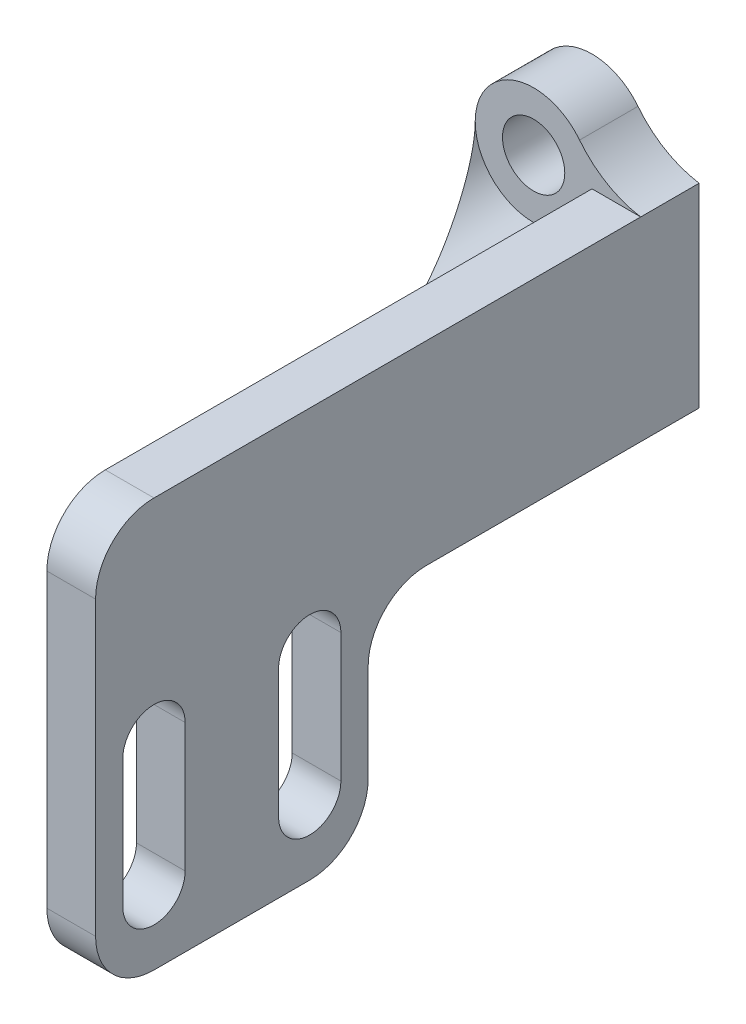
from build123d import *

# Parameters (mm, degrees)
SKETCH_1_R          = 1.6
EXTRUDE_1_DEPTH     = 3
SKETCH_3_W          = 2.5
SKETCH_3_H          = 10
EXTRUDE_2_DEPTH     = 28
FILLET_1_R          = 5
FILLET_2_R          = 5
SKETCH_4_W          = 14
SKETCH_4_H          = 11
EXTRUDE_3_DEPTH     = 2.5
CUT_EXTRUDE_1_DEPTH = 63.851944341
EXTRUDE_4_DEPTH     = 10
SKETCH_8_R          = 3
CUT_EXTRUDE_2_DEPTH = 62.084915548
FILLET_3_R          = 3


with BuildPart() as part:
    # 草图1 → 凸台-拉伸1 (new body)
    with BuildSketch(Plane.XY):
        with BuildLine():
            ThreePointArc((3, -33.010340746), (0, -30.010340746), (-3, -33.010340746))
            Line((-3, -33.010340746), (-3, -43.010340746))
            ThreePointArc((-3, -43.010340746), (0, -46.010340746), (3, -43.010340746))
            Line((3, -43.010340746), (5.5, -43.010340746))
            Line((5.5, -43.010340746), (5.5, -33.010340746))
            Line((5.5, -33.010340746), (3, -33.010340746))
        make_face()
        with Locations((0, -33.010340746)):
            Circle(SKETCH_1_R, mode=Mode.SUBTRACT)
        with Locations((0, -43.010340746)):
            Circle(SKETCH_1_R, mode=Mode.SUBTRACT)
    extrude(amount=EXTRUDE_1_DEPTH)

    # 草图3 → 凸台-拉伸2 (add)
    with BuildSketch(Plane.XY.offset(3)):
        with Locations((4.25, -38.010340746)):
            Rectangle(SKETCH_3_W, SKETCH_3_H)
    extrude(amount=EXTRUDE_2_DEPTH)

    # 圆角1
    # the kernel refuses this fillet: 5 mm, written as the material it adds along each edge
    with BuildSketch(Plane(origin=(3, -43.010340746, 0), x_dir=(-0.32639560491693326, -0.9452332564456825, 0), z_dir=(0, 0, 1))) as fillet_1_piece_1:
        with BuildLine():
            CenterArc((3.590351654, 4.726166282), FILLET_1_R, 208.20428203, 42.745569225)
            Line((-0.815989012, 2.363083141), (0, 0))
            ThreePointArc((0, 0), (0.979186815, 0.164300231), (1.95837363, 0))
        make_face()
    extrude(amount=3)

    # 圆角2
    # the kernel refuses this fillet: 5 mm, written as the material it adds along each edge
    with BuildSketch(Plane(origin=(3, -33.010340746, 0), x_dir=(1, 0, 0), z_dir=(0, 0, 1))) as fillet_2_piece_1:
        with BuildLine():
            CenterArc((3.295454545, 4.936319688), FILLET_2_R, 218.100297491, 42.745569225)
            ThreePointArc((-0.639204545, 1.851119883), (-0.164300231, 0.979186815), (0, 0))
            Line((0, 0), (2.5, 0))
        make_face()
    extrude(amount=3)

    # 草图4 → 凸台-拉伸3 (add)
    with BuildSketch(Plane(origin=(5.5, 0, 0), x_dir=(0, 0, -1), z_dir=(1, 0, 0))):
        with Locations((-24, -48.510340746)):
            Rectangle(SKETCH_4_W, SKETCH_4_H)
    extrude(amount=-EXTRUDE_3_DEPTH)

    # 草图5 → 切除-拉伸1 (cut, through all)
    with BuildSketch(Plane(origin=(5.5, 0, 0), x_dir=(0, 0, -1), z_dir=(1, 0, 0))):
        with BuildLine():
            Line((-26.4, -50.402762968), (-26.4, -43.797439087))
            ThreePointArc((-26.4, -43.797439087), (-28, -42.197439087), (-29.6, -43.797439087))
            Line((-29.6, -43.797439087), (-29.6, -50.402762968))
            ThreePointArc((-29.6, -50.402762968), (-28, -52.002762968), (-26.4, -50.402762968))
        make_face()
        with BuildLine():
            Line((-21.6, -50.402762968), (-21.6, -43.797439087))
            ThreePointArc((-21.6, -43.797439087), (-20, -42.197439087), (-18.4, -43.797439087))
            Line((-18.4, -43.797439087), (-18.4, -50.402762968))
            ThreePointArc((-18.4, -50.402762968), (-20, -52.002762968), (-21.6, -50.402762968))
        make_face()
    extrude(amount=-CUT_EXTRUDE_1_DEPTH, mode=Mode.SUBTRACT)

    # 草图6 → 凸台-拉伸4 (add)
    with BuildSketch(Plane.XZ.offset(43.010340746)):
        Polygon((3, 14), (-3, 3), (3, 3), align=None)
    extrude(amount=-EXTRUDE_4_DEPTH)

    # 草图8 → 切除-拉伸2 (cut, through all)
    with BuildSketch(Plane.XY.offset(3)):
        with Locations((0, -43.010340746)):
            Circle(SKETCH_8_R)
        with Locations((0, -33.010340746)):
            Circle(SKETCH_8_R)
    extrude(amount=CUT_EXTRUDE_2_DEPTH, mode=Mode.SUBTRACT)

    # 圆角3
    fillet_3_edges = [part.edges().sort_by_distance(p)[0] for p in [
        (4.25, -43.010340746, 17),
        (4.25, -54.010340746, 17),
        (4.25, -54.010340746, 31),
        (4.25, -33.010340746, 31),
    ]]
    fillet(fillet_3_edges, radius=FILLET_3_R)


solid = part.part
